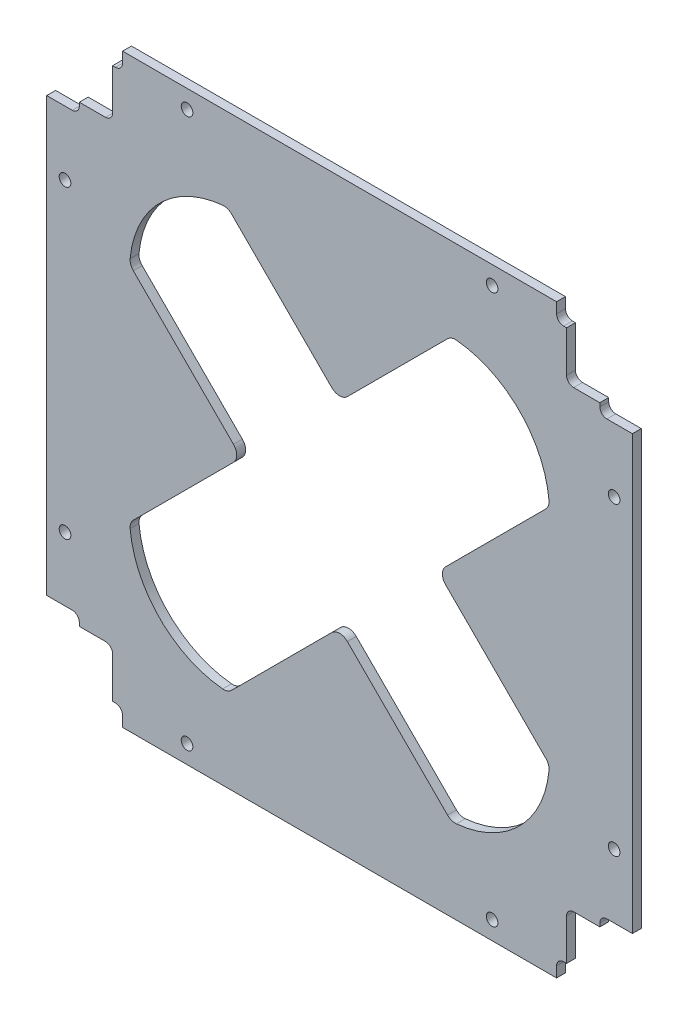
from build123d import *

# Parameters (mm, degrees)
SKETCH1_W                            = 106
SKETCH1_H                            = 106
MAINOUTLINE_DEPTH                    = 1.6
SKETCH4_W                            = 11.7
SKETCH4_H                            = 11.7
RAILCUTOUTS_DEPTH                    = 75.970394157
SKETCH13_W                           = 5.7
SKETCH13_H                           = 1.9
SKETCH13_W_2                         = 1.8
SKETCH13_H_2                         = 3
FILLETCUTOUTS_DEPTH                  = 75.970394157
SMOOTHCORNER_DEPTH                   = 10
MIRROR2_COPY_1_SKETCH_W              = 11.7
MIRROR2_COPY_1_SKETCH_H              = 11.7
MIRROR2_COPY_1_DEPTH                 = 75.970394157
MIRROR2_COPY_2_SKETCH_W              = 5.7
MIRROR2_COPY_2_SKETCH_H              = 1.9
MIRROR2_COPY_2_SKETCH_W_2            = 1.8
MIRROR2_COPY_2_SKETCH_H_2            = 3
MIRROR2_COPY_2_DEPTH                 = 75.970394157
MIRROR2_COPY_3_DEPTH                 = 10
MIRROR2_COPY_4_SKETCH_W              = 11.7
MIRROR2_COPY_4_SKETCH_H              = 11.7
MIRROR2_COPY_4_DEPTH                 = 75.970394157
MIRROR2_COPY_5_SKETCH_W              = 5.7
MIRROR2_COPY_5_SKETCH_H              = 1.9
MIRROR2_COPY_5_SKETCH_W_2            = 1.8
MIRROR2_COPY_5_SKETCH_H_2            = 3
MIRROR2_COPY_5_DEPTH                 = 75.970394157
MIRROR2_COPY_6_DEPTH                 = 10
M2_CLEARANCE_HOLE1_D                 = 2.1
SKETCH15_W                           = 90
SKETCH15_H                           = 6.2
SKETCH15_W_2                         = 5.2
SKETCH15_H_2                         = 90
CUT_EXTRUDE5_DEPTH                   = 0.001
F_1I_CIRCULAR_TURNSTILE_CUTOUT_DEPTH = 10
SKETCH24_OUTSIDE_W                   = 137.984
SKETCH24_OUTSIDE_H                   = 137.984
SKETCH24_OUTSIDE_W_2                 = 105.6
SKETCH24_OUTSIDE_H_2                 = 105.6
CUT_EXTRUDE19_DEPTH                  = 75.970394157
FILLET9_R                            = 2


with BuildPart() as part:
    # Sketch1 → mainOutline (new body)
    with BuildSketch(Plane.XY):
        Rectangle(SKETCH1_W, SKETCH1_H)
    extrude(amount=MAINOUTLINE_DEPTH)

    # Sketch4 → railCutouts (cut, through all)
    with BuildSketch(Plane(origin=(0, 0, 0), x_dir=(-1, 0, 0), z_dir=(0, 0, -1))):
        with Locations((47.15, 47.15)):
            Rectangle(SKETCH4_W, SKETCH4_H)
    railcutouts = extrude(amount=-RAILCUTOUTS_DEPTH, mode=Mode.SUBTRACT)

    # Sketch13 → filletCutouts (cut, symmetric)
    with BuildSketch(Plane(origin=(0, 0, 0), x_dir=(-1, 0, 0), z_dir=(0, 0, -1))):
        with Locations((50.15, 40.35)):
            Rectangle(SKETCH13_W, SKETCH13_H)
        with Locations((40.4, 51.5)):
            Rectangle(SKETCH13_W_2, SKETCH13_H_2)
    filletcutouts = extrude(amount=FILLETCUTOUTS_DEPTH, both=True, mode=Mode.SUBTRACT)

    # Sketch27 → smoothCorner (cut)
    with BuildSketch(Plane.XY.offset(1.6)):
        with BuildLine():
            Line((-40.928025612, 42.198025612), (-40.928025612, 49.628025612))
            Line((-40.928025612, 49.628025612), (-40.398025612, 49.628025612))
            ThreePointArc((-40.398025612, 49.628025612), (-39.5, 50), (-39.128025612, 50.898025612))
            Line((-39.128025612, 50.898025612), (-39.128025612, 53))
            Line((-39.128025612, 53), (-53, 53))
            Line((-53, 53), (-53, 39.028025612))
            Line((-53, 39.028025612), (-48.198025612, 39.028025612))
            ThreePointArc((-48.198025612, 39.028025612), (-47.3, 39.4), (-46.928025612, 40.298025612))
            Line((-46.928025612, 40.298025612), (-46.928025612, 40.928025612))
            Line((-46.928025612, 40.928025612), (-42.198025612, 40.928025612))
            ThreePointArc((-42.198025612, 40.928025612), (-41.3, 41.3), (-40.928025612, 42.198025612))
        make_face()
    smoothcorner = extrude(amount=-SMOOTHCORNER_DEPTH, mode=Mode.SUBTRACT)

    # Mirror1: railCutouts, filletCutouts, smoothCorner across plane
    add(railcutouts.mirror(Plane(origin=(0, 0, 0), x_dir=(0, 0, 1), z_dir=(1, 0, 0))), mode=Mode.SUBTRACT)
    add(filletcutouts.mirror(Plane(origin=(0, 0, 0), x_dir=(0, 0, 1), z_dir=(1, 0, 0))), mode=Mode.SUBTRACT)
    add(smoothcorner.mirror(Plane(origin=(0, 0, 0), x_dir=(0, 0, 1), z_dir=(1, 0, 0))), mode=Mode.SUBTRACT)

    # Mirror2 copy 1 sketch → Mirror2 copy 1 (cut, through all)
    with BuildSketch(Plane(origin=(0, 0, 0), x_dir=(1, 0, 0), z_dir=(0, 0, -1))):
        with Locations((47.15, 47.15)):
            Rectangle(MIRROR2_COPY_1_SKETCH_W, MIRROR2_COPY_1_SKETCH_H)
    extrude(amount=-MIRROR2_COPY_1_DEPTH, mode=Mode.SUBTRACT)

    # Mirror2 copy 2 sketch → Mirror2 copy 2 (cut, symmetric)
    with BuildSketch(Plane(origin=(0, 0, 0), x_dir=(1, 0, 0), z_dir=(0, 0, -1))):
        with Locations((50.15, 40.35)):
            Rectangle(MIRROR2_COPY_2_SKETCH_W, MIRROR2_COPY_2_SKETCH_H)
        with Locations((40.4, 51.5)):
            Rectangle(MIRROR2_COPY_2_SKETCH_W_2, MIRROR2_COPY_2_SKETCH_H_2)
    extrude(amount=MIRROR2_COPY_2_DEPTH, both=True, mode=Mode.SUBTRACT)

    # Mirror2 copy 3 sketch → Mirror2 copy 3 (cut)
    with BuildSketch(Plane(origin=(0, 0, 1.6), x_dir=(-1, 0, 0), z_dir=(0, 0, 1))):
        with BuildLine():
            Line((-40.928025612, 42.198025612), (-40.928025612, 49.628025612))
            Line((-40.928025612, 49.628025612), (-40.398025612, 49.628025612))
            ThreePointArc((-40.398025612, 49.628025612), (-39.5, 50), (-39.128025612, 50.898025612))
            Line((-39.128025612, 50.898025612), (-39.128025612, 53))
            Line((-39.128025612, 53), (-53, 53))
            Line((-53, 53), (-53, 39.028025612))
            Line((-53, 39.028025612), (-48.198025612, 39.028025612))
            ThreePointArc((-48.198025612, 39.028025612), (-47.3, 39.4), (-46.928025612, 40.298025612))
            Line((-46.928025612, 40.298025612), (-46.928025612, 40.928025612))
            Line((-46.928025612, 40.928025612), (-42.198025612, 40.928025612))
            ThreePointArc((-42.198025612, 40.928025612), (-41.3, 41.3), (-40.928025612, 42.198025612))
        make_face()
    extrude(amount=-MIRROR2_COPY_3_DEPTH, mode=Mode.SUBTRACT)

    # Mirror2 copy 4 sketch → Mirror2 copy 4 (cut, through all)
    with BuildSketch(Plane(origin=(0, 0, 0), x_dir=(-1, 0, 0), z_dir=(0, 0, -1))):
        with Locations((47.15, -47.15)):
            Rectangle(MIRROR2_COPY_4_SKETCH_W, MIRROR2_COPY_4_SKETCH_H)
    extrude(amount=-MIRROR2_COPY_4_DEPTH, mode=Mode.SUBTRACT)

    # Mirror2 copy 5 sketch → Mirror2 copy 5 (cut, symmetric)
    with BuildSketch(Plane(origin=(0, 0, 0), x_dir=(-1, 0, 0), z_dir=(0, 0, -1))):
        with Locations((50.15, -40.35)):
            Rectangle(MIRROR2_COPY_5_SKETCH_W, MIRROR2_COPY_5_SKETCH_H)
        with Locations((40.4, -51.5)):
            Rectangle(MIRROR2_COPY_5_SKETCH_W_2, MIRROR2_COPY_5_SKETCH_H_2)
    extrude(amount=MIRROR2_COPY_5_DEPTH, both=True, mode=Mode.SUBTRACT)

    # Mirror2 copy 6 sketch → Mirror2 copy 6 (cut)
    with BuildSketch(Plane.XY.offset(1.6)):
        with BuildLine():
            Line((-40.928025612, -42.198025612), (-40.928025612, -49.628025612))
            Line((-40.928025612, -49.628025612), (-40.398025612, -49.628025612))
            ThreePointArc((-40.398025612, -49.628025612), (-39.5, -50), (-39.128025612, -50.898025612))
            Line((-39.128025612, -50.898025612), (-39.128025612, -53))
            Line((-39.128025612, -53), (-53, -53))
            Line((-53, -53), (-53, -39.028025612))
            Line((-53, -39.028025612), (-48.198025612, -39.028025612))
            ThreePointArc((-48.198025612, -39.028025612), (-47.3, -39.4), (-46.928025612, -40.298025612))
            Line((-46.928025612, -40.298025612), (-46.928025612, -40.928025612))
            Line((-46.928025612, -40.928025612), (-42.198025612, -40.928025612))
            ThreePointArc((-42.198025612, -40.928025612), (-41.3, -41.3), (-40.928025612, -42.198025612))
        make_face()
    extrude(amount=-MIRROR2_COPY_6_DEPTH, mode=Mode.SUBTRACT)

    # M2 Clearance Hole1 (through all)
    with Locations(Plane(origin=(0, 0, 0), x_dir=(-1, 0, 0), z_dir=(0, 0, -1))):
        with Locations((49.5, -27.5), (27.5, -49.5), (-49.5, -27.5), (-27.5, -49.5), (-27.5, 49.5), (-49.5, 27.5), (27.5, 49.5), (49.5, 27.5)):
            Hole(M2_CLEARANCE_HOLE1_D / 2)

    # Sketch15 → Cut-Extrude5 (cut)
    with BuildSketch(Plane(origin=(0, 0, 0), x_dir=(-1, 0, 0), z_dir=(0, 0, -1))):
        with Locations((0, 49.9)):
            Rectangle(SKETCH15_W, SKETCH15_H)
        with Locations((0, -49.9)):
            Rectangle(SKETCH15_W, SKETCH15_H)
        with Locations((-50.4, 0)):
            Rectangle(SKETCH15_W_2, SKETCH15_H_2)
        with Locations((50.4, 0)):
            Rectangle(SKETCH15_W_2, SKETCH15_H_2)
    extrude(amount=-CUT_EXTRUDE5_DEPTH, mode=Mode.SUBTRACT)

    # Sketch26 → 1I circular turnstile cutout (cut)
    with BuildSketch(Plane.XY.offset(1.6)):
        with BuildLine():
            Line((-17.713024869, 0), (-37.827495367, 20.114470498))
            ThreePointArc((-37.827495367, 20.114470498), (-32.425039857, 32.425039857), (-20.114470498, 37.827495367))
            Line((-20.114470498, 37.827495367), (0, 17.713024869))
            Line((0, 17.713024869), (20.114470498, 37.827495367))
            ThreePointArc((20.114470498, 37.827495367), (32.425039857, 32.425039857), (37.827495367, 20.114470498))
            Line((37.827495367, 20.114470498), (17.713024869, 0))
            Line((17.713024869, 0), (37.827495367, -20.114470498))
            ThreePointArc((37.827495367, -20.114470498), (32.425039857, -32.425039857), (20.114470498, -37.827495367))
            Line((20.114470498, -37.827495367), (0, -17.713024869))
            Line((0, -17.713024869), (-20.114470498, -37.827495367))
            ThreePointArc((-20.114470498, -37.827495367), (-32.425039857, -32.425039857), (-37.827495367, -20.114470498))
            Line((-37.827495367, -20.114470498), (-17.713024869, 0))
        make_face()
    extrude(amount=-F_1I_CIRCULAR_TURNSTILE_CUTOUT_DEPTH, mode=Mode.SUBTRACT)

    # Sketch24 outside → Cut-Extrude19 (cut, through all)
    with BuildSketch(Plane.XY.offset(1.6)):
        Rectangle(SKETCH24_OUTSIDE_W, SKETCH24_OUTSIDE_H)
        Rectangle(SKETCH24_OUTSIDE_W_2, SKETCH24_OUTSIDE_H_2, mode=Mode.SUBTRACT)
    extrude(amount=-CUT_EXTRUDE19_DEPTH, mode=Mode.SUBTRACT)

    # Fillet9
    fillet9_edges = [part.edges().sort_by_distance(p)[0] for p in [
        (0, -17.713024869, 0.8),
        (17.713024869, 0, 0.8),
        (-17.713024869, 0, 0.8),
        (0, 17.713024869, 0.8),
        (-37.827495367, -20.114470498, 0.8),
        (-20.114470498, -37.827495367, 0.8),
        (20.114470498, -37.827495367, 0.8),
        (37.827495367, -20.114470498, 0.8),
        (37.827495367, 20.114470498, 0.8),
        (20.114470498, 37.827495367, 0.8),
        (-37.827495367, 20.114470498, 0.8),
        (-20.114470498, 37.827495367, 0.8),
    ]]
    fillet(fillet9_edges, radius=FILLET9_R)


solid = part.part
